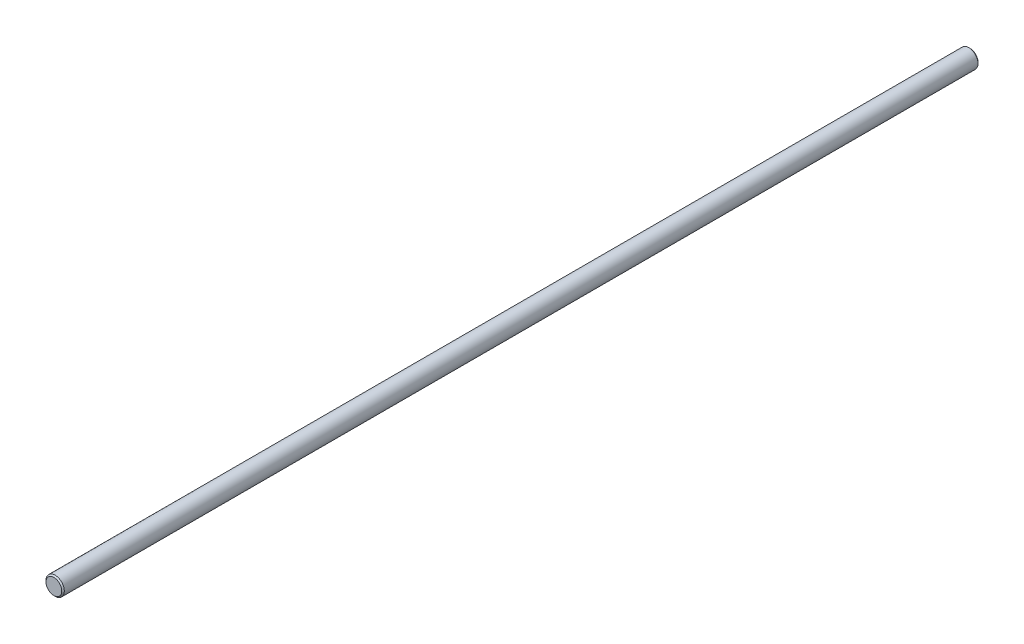
from build123d import *

# Parameters (mm, degrees)
BOSS_EXTRUDE1_DEPTH      = 150
BOSS_EXTRUDE1_DEPTH_BACK = 150
SKETCH3_R                = 3
CHAMFER1_SIZE            = 0.42


with BuildPart() as part:
    # Sketch3 → Boss-Extrude1 (new, two sides: drawn at the far end of the back side and taken through both)
    with BuildSketch(Plane.XY.offset(-BOSS_EXTRUDE1_DEPTH_BACK)):
        Circle(SKETCH3_R)
    extrude(amount=BOSS_EXTRUDE1_DEPTH + BOSS_EXTRUDE1_DEPTH_BACK)

    # Chamfer1
    chamfer1_edges = [part.edges().sort_by_distance(p)[0] for p in [
        (-3, 0, -150),
        (-3, 0, 150),
    ]]
    chamfer(chamfer1_edges, length=CHAMFER1_SIZE)


solid = part.part
